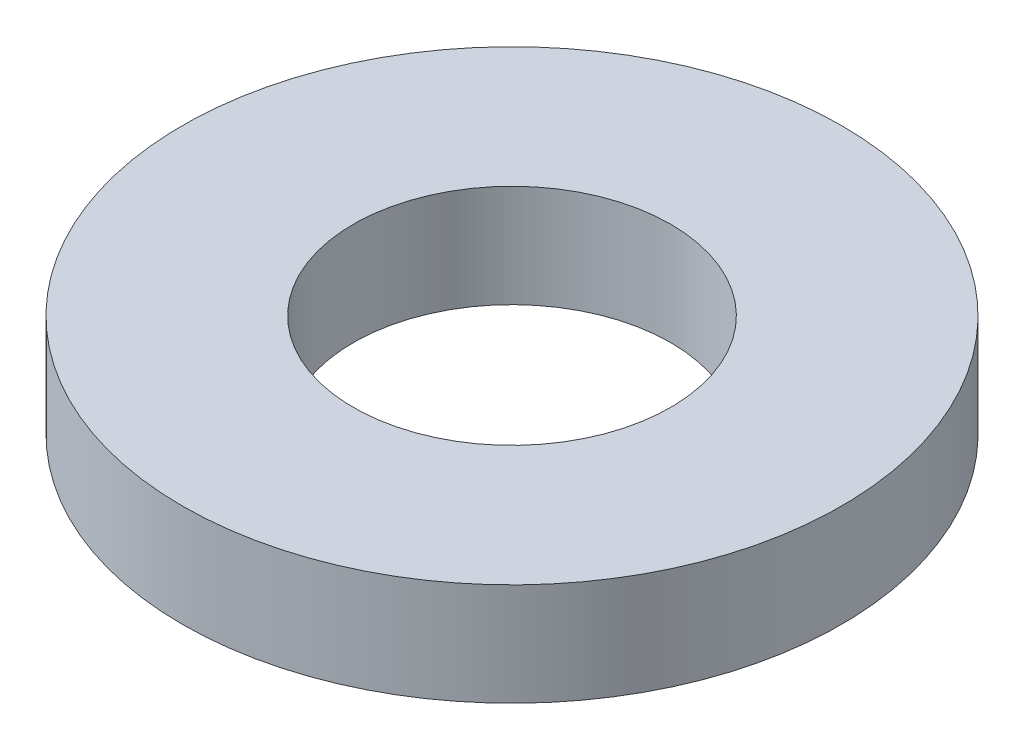
from build123d import *

# Parameters (mm, degrees)
SKETCH1_R           = 67.5
BOSS_EXTRUDE1_DEPTH = 21
SKETCH2_R           = 32.5
CUT_EXTRUDE1_DEPTH  = 98.742007346


with BuildPart() as part:
    # Sketch1 → Boss-Extrude1 (new body)
    with BuildSketch(Plane(origin=(0, 0, 0), x_dir=(1, 0, 0), z_dir=(0, 1, 0))):
        Circle(SKETCH1_R)
    extrude(amount=BOSS_EXTRUDE1_DEPTH)

    # Sketch2 → Cut-Extrude1 (cut, through all)
    with BuildSketch(Plane(origin=(0, 0, 0), x_dir=(1, 0, 0), z_dir=(0, 1, 0))):
        Circle(SKETCH2_R)
    extrude(amount=CUT_EXTRUDE1_DEPTH, mode=Mode.SUBTRACT)


solid = part.part
